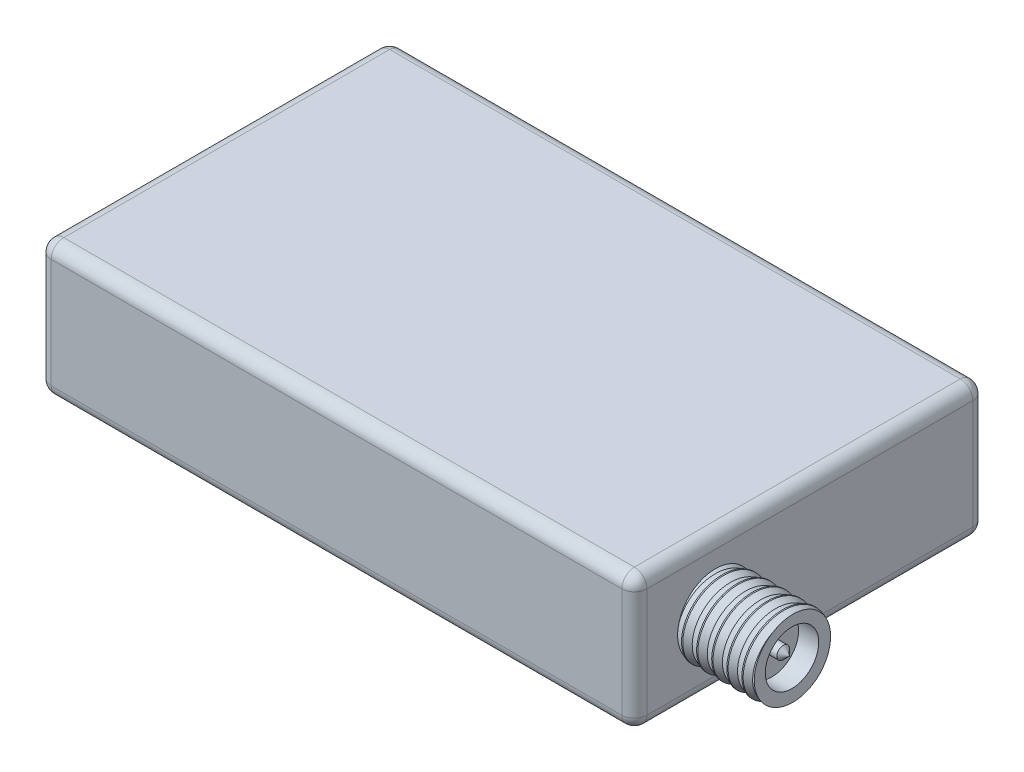
from build123d import *

# Parameters (mm, degrees)
SKETCH1_W           = 47.36
SKETCH1_H           = 27.9
BOSS_EXTRUDE1_DEPTH = 5.35
SKETCH2_R           = 3.125
BOSS_EXTRUDE2_DEPTH = 6.15
SKETCH3_W           = 11.2
SKETCH3_H           = 5
CUT_EXTRUDE1_DEPTH  = 7
SKETCH5_W           = 8.9
SKETCH5_H           = 3.2
CUT_EXTRUDE2_DEPTH  = 6
SKETCH6_R           = 2.125
CUT_EXTRUDE3_DEPTH  = 1.6
SKETCH7_R           = 0.5
BOSS_EXTRUDE3_DEPTH = 1.4
CHAMFER1_SIZE       = 0.5
CUT_SWEEP1_PITCH    = 1.2
CUT_SWEEP1_FROM     = 0
SKETCH11_W          = 11.2
SKETCH11_H          = 5
SKETCH11_W_2        = 10.75
SKETCH11_H_2        = 4.25
BOSS_EXTRUDE5_DEPTH = 7
SKETCH12_W          = 8.9
SKETCH12_H          = 3.2
SKETCH12_W_2        = 7.5
SKETCH12_H_2        = 2.45
BOSS_EXTRUDE6_DEPTH = 6
FILLET1_R           = 1


with BuildPart() as part:
    # Sketch1 → Boss-Extrude1 (new, symmetric)
    with BuildSketch(Plane(origin=(0, 0, 0), x_dir=(1, 0, 0), z_dir=(0, 1, 0))):
        Rectangle(SKETCH1_W, SKETCH1_H)
    extrude(amount=BOSS_EXTRUDE1_DEPTH, both=True)

    # Sketch2 → Boss-Extrude2 (add)
    with BuildSketch(Plane(origin=(23.68, 0, 0), x_dir=(0, 0, -1), z_dir=(1, 0, 0))):
        with Locations(Location((-7.575, 0, 0), (0, 0, 180))):
            Circle(SKETCH2_R)
    extrude(amount=BOSS_EXTRUDE2_DEPTH)

    # Sketch3 → Cut-Extrude1 (cut)
    with BuildSketch(Plane.ZY.offset(23.68)):
        with Locations((-4.65, -1.55)):
            Rectangle(SKETCH3_W, SKETCH3_H)
    extrude(amount=-CUT_EXTRUDE1_DEPTH, mode=Mode.SUBTRACT)

    # Sketch5 → Cut-Extrude2 (cut)
    with BuildSketch(Plane.ZY.offset(23.68)):
        with Locations((5.4, -0.65)):
            Rectangle(SKETCH5_W, SKETCH5_H)
    extrude(amount=-CUT_EXTRUDE2_DEPTH, mode=Mode.SUBTRACT)

    # Sketch6 → Cut-Extrude3 (cut)
    with BuildSketch(Plane(origin=(29.83, 0, 0), x_dir=(0, 0, -1), z_dir=(1, 0, 0))):
        with Locations((-7.575, 0)):
            Circle(SKETCH6_R)
    extrude(amount=-CUT_EXTRUDE3_DEPTH, mode=Mode.SUBTRACT)

    # Sketch7 → Boss-Extrude3 (add)
    with BuildSketch(Plane(origin=(28.23, 0, 0), x_dir=(0, 0, -1), z_dir=(1, 0, 0))):
        with Locations((-7.575, 0)):
            Circle(SKETCH7_R)
    extrude(amount=BOSS_EXTRUDE3_DEPTH)

    # Chamfer1
    chamfer1_edges = [part.edges().sort_by_distance(p)[0] for p in [
        (29.63, 0, 8.075),
    ]]
    chamfer(chamfer1_edges, length=CHAMFER1_SIZE)

    # Cut-Sweep1: arcs per turn and ends read off the stored shape
    # Cut-Sweep1: the profile of Sketch9 profile screwed along a left-hand helix through 7 turns, 8 arcs to a turn; built about Z, then put on its axis
    cut_sweep1_z = Axis((0, 0, 0), (0, 0, 1))
    cut_sweep1_corners = [(3.1253, 0, -1.200825), (2.925, 0, -0.65), (3.1253, 0, -0.099175)]
    with BuildLine(mode=Mode.PRIVATE) as cut_sweep1_profile:
        Line(cut_sweep1_corners[0], cut_sweep1_corners[1])
        Line(cut_sweep1_corners[1], cut_sweep1_corners[2])
        Line(cut_sweep1_corners[2], cut_sweep1_corners[0])
    cut_sweep1_cap = Face(cut_sweep1_profile.wire())
    cut_sweep1_turn_angles = [0, -22.5, -45, -67.5, -90, -112.5, -135, -157.5, -180, -202.5, -225, -247.5, -270, -292.5, -315, -337.5, -360]
    cut_sweep1_turn_weights = [1, 0.9238795325112867, 1, 0.9238795325112867, 1, 0.9238795325112867, 1, 0.9238795325112867, 1, 0.9238795325112867, 1, 0.9238795325112867, 1, 0.9238795325112867, 1, 0.9238795325112867, 1]
    cut_sweep1_turn_rails = [Edge.make_bspline([Vector(p[0], p[1], 0).rotate(cut_sweep1_z, cut_sweep1_turn_angles[k]) / cut_sweep1_turn_weights[k] + Vector(0, 0, p[2] + -CUT_SWEEP1_PITCH * cut_sweep1_turn_angles[k] / 360) for k in range(17)], [0, 0, 0, 1, 1, 2, 2, 3, 3, 4, 4, 5, 5, 6, 6, 7, 7, 8, 8, 8], 2, cut_sweep1_turn_weights) for p in cut_sweep1_corners]
    cut_sweep1_turn_sides = [Face.make_surface_from_curves(cut_sweep1_turn_rails[p[0]], cut_sweep1_turn_rails[p[1]]) for p in [(0, 1), (1, 2), (2, 0)]]
    cut_sweep1 = Plane(origin=(23.68, 0, 7.575), x_dir=(0, 0, -1), z_dir=(1, 0, 0)) * split(Solid(Shell([*[p.moved(Location((0, 0, CUT_SWEEP1_PITCH * i))) for i in range(7) for p in cut_sweep1_turn_sides], cut_sweep1_cap, cut_sweep1_cap.rotate(cut_sweep1_z, -2520).moved(Location((0, 0, -CUT_SWEEP1_PITCH * -2520 / 360)))])), bisect_by=Plane.XY.offset(CUT_SWEEP1_FROM), keep=Keep.TOP, mode=Mode.PRIVATE)
    add(cut_sweep1, mode=Mode.SUBTRACT)

    # Sketch11 → Boss-Extrude5 (add)
    with BuildSketch(Plane.ZY.offset(16.68)):
        with Locations((-4.65, -1.55)):
            Rectangle(SKETCH11_W, SKETCH11_H)
        with Locations((-4.65, -1.55)):
            Rectangle(SKETCH11_W_2, SKETCH11_H_2, mode=Mode.SUBTRACT)
    extrude(amount=BOSS_EXTRUDE5_DEPTH)

    # Sketch12 → Boss-Extrude6 (add)
    with BuildSketch(Plane.ZY.offset(17.68)):
        with Locations((5.4, -0.65)):
            Rectangle(SKETCH12_W, SKETCH12_H)
        with Locations((5.4, -0.65)):
            Rectangle(SKETCH12_W_2, SKETCH12_H_2, mode=Mode.SUBTRACT)
    extrude(amount=BOSS_EXTRUDE6_DEPTH)

    # Fillet1
    fillet1_edges = [part.edges().sort_by_distance(p)[0] for p in [
        (23.68, 5.35, 0),
        (0, 5.35, -13.95),
        (-23.68, 5.35, 0),
        (0, -5.35, -13.95),
        (23.68, -5.35, 0),
        (0, -5.35, 13.95),
        (-23.68, -5.35, 0),
        (-23.68, 0, -13.95),
        (23.68, 0, -13.95),
        (23.68, 0, 13.95),
        (-23.68, 0, 13.95),
        (0, 5.35, 13.95),
    ]]
    fillet(fillet1_edges, radius=FILLET1_R)


solid = part.part
